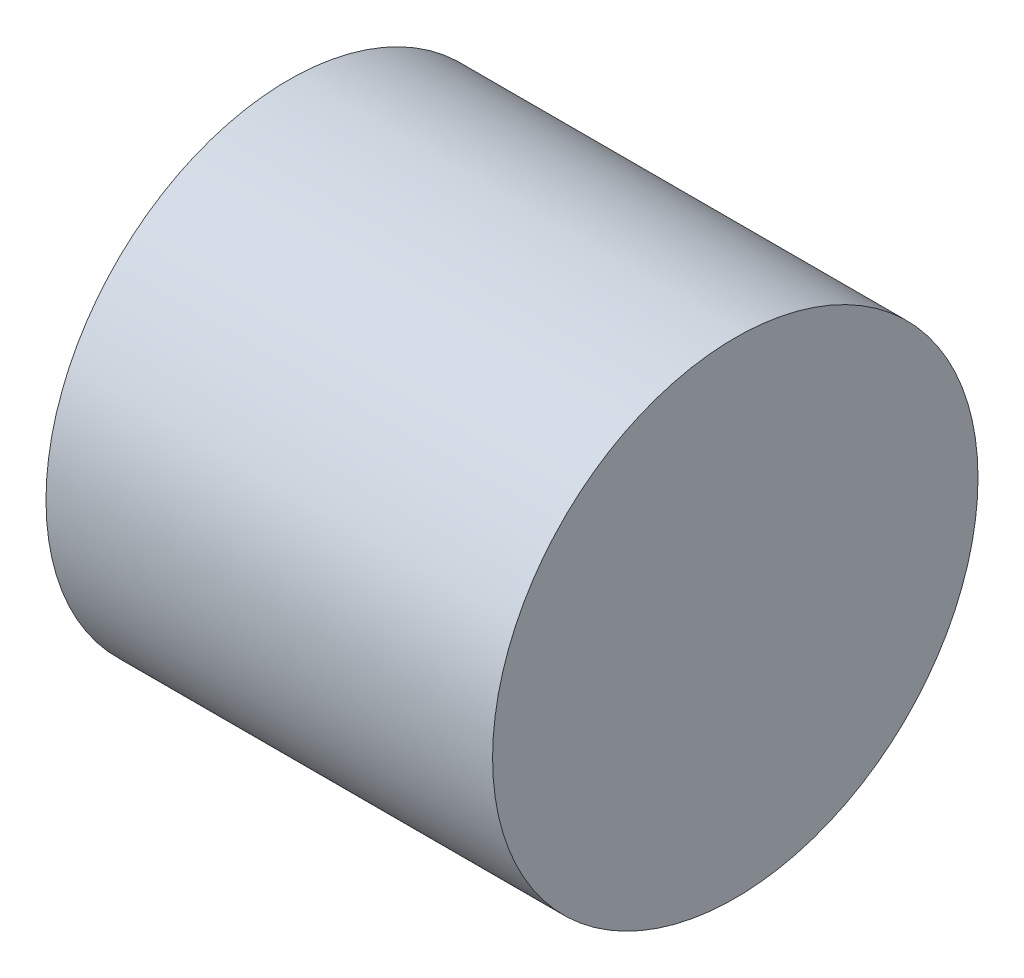
from build123d import *

# Parameters (mm, degrees)
SKETCH1_R           = 12.5
BOSS_EXTRUDE1_DEPTH = 23
CUT_EXTRUDE1_DEPTH  = 10


with BuildPart() as part:
    # Sketch1 → Boss-Extrude1 (new body)
    with BuildSketch(Plane(origin=(0, 0, 0), x_dir=(0, 0, -1), z_dir=(1, 0, 0))):
        Circle(SKETCH1_R)
    extrude(amount=BOSS_EXTRUDE1_DEPTH)

    # Sketch2 → Cut-Extrude1 (cut)
    with BuildSketch(Plane.ZY):
        with BuildLine():
            ThreePointArc((3, 0), (-0.507305936, 2.956795679), (-2.828427125, -1))
            Line((-2.828427125, -1), (2.828427125, -1))
            ThreePointArc((2.828427125, -1), (2.956795679, -0.507305936), (3, 0))
        make_face()
    extrude(amount=-CUT_EXTRUDE1_DEPTH, mode=Mode.SUBTRACT)


solid = part.part
